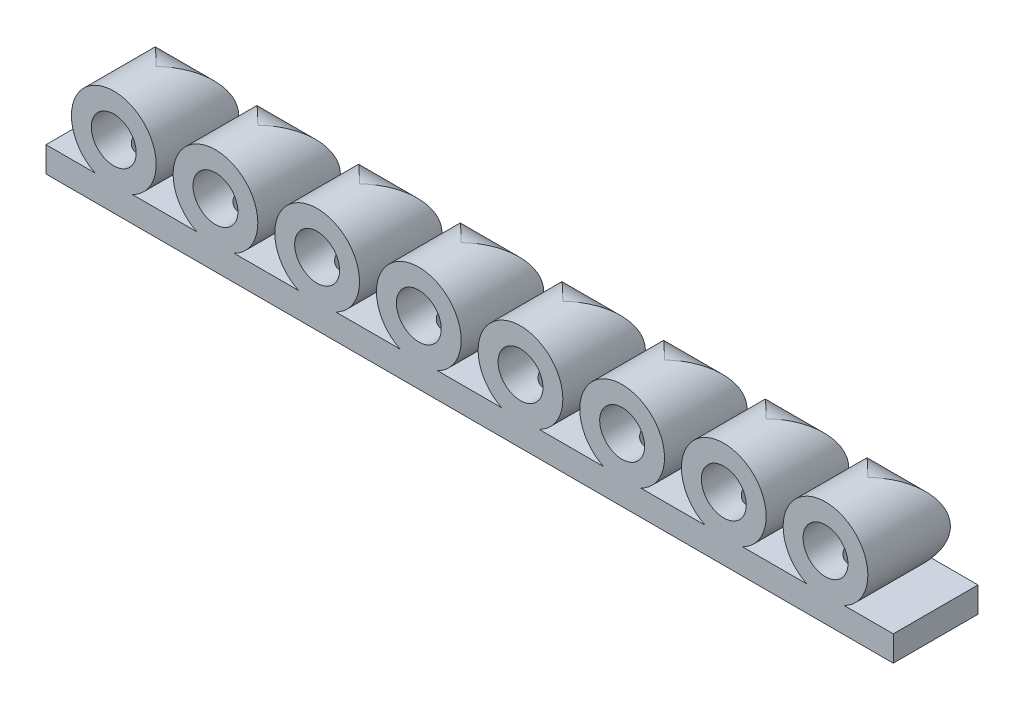
from build123d import *
from build123d.topology import SkipClean

# Parameters (mm, degrees)
BOSS_EXTRUDE1_DEPTH = 10
CUT_EXTRUDE1_DEPTH  = 102.097506416
SKETCH3_R           = 2.65
CUT_EXTRUDE2_DEPTH  = 8
SKETCH4_R           = 1.5
CUT_EXTRUDE3_DEPTH  = 8


with BuildPart() as part:
    # Sketch1 → Boss-Extrude1 (new body)
    with BuildSketch(Plane.XY):
        with BuildLine():
            Line((-39.793136328, 1.5), (-32.206863672, 1.5))
            ThreePointArc((-32.206863672, 1.5), (-30, 10.986619299), (-27.793136328, 1.5))
            Line((-27.793136328, 1.5), (-20.206863672, 1.5))
            ThreePointArc((-20.206863672, 1.5), (-18, 10.986619299), (-15.793136328, 1.5))
            Line((-15.793136328, 1.5), (-8.206863672, 1.5))
            ThreePointArc((-8.206863672, 1.5), (-6, 10.986619299), (-3.793136328, 1.5))
            Line((-3.793136328, 1.5), (3.793136328, 1.5))
            ThreePointArc((3.793136328, 1.5), (6, 10.986619299), (8.206863672, 1.5))
            Line((8.206863672, 1.5), (15.793136328, 1.5))
            ThreePointArc((15.793136328, 1.5), (18, 10.986619299), (20.206863672, 1.5))
            Line((20.206863672, 1.5), (27.793136328, 1.5))
            ThreePointArc((27.793136328, 1.5), (30, 10.986619299), (32.206863672, 1.5))
            Line((32.206863672, 1.5), (39.793136328, 1.5))
            ThreePointArc((39.793136328, 1.5), (42, 10.986619299), (44.206863672, 1.5))
            Line((44.206863672, 1.5), (50, 1.5))
            Line((50, 1.5), (50, -1.5))
            Line((50, -1.5), (-50, -1.5))
            Line((-50, -1.5), (-50, 1.5))
            Line((-50, 1.5), (-44.206863672, 1.5))
            ThreePointArc((-44.206863672, 1.5), (-42, 10.986619299), (-39.793136328, 1.5))
        make_face()
    extrude(amount=BOSS_EXTRUDE1_DEPTH)

    # Sketch2 → Cut-Extrude1 (cut, through all)
    with SkipClean():  # the faces are left unmerged after this step: merging them gives an invalid solid
        with BuildSketch(Plane.ZY.offset(50)):
            with BuildLine():
                Line((5, 10.986619299), (0, 10.986619299))
                Line((0, 10.986619299), (0, 1.5))
                Line((0, 1.5), (5, 1.5))
                ThreePointArc((5, 1.5), (0.25669035, 6.24330965), (5, 10.986619299))
            make_face()
        extrude(amount=-CUT_EXTRUDE1_DEPTH, mode=Mode.SUBTRACT)

    # Sketch3 → Cut-Extrude2 (cut)
    with SkipClean():  # the faces are left unmerged after this step: merging them gives an invalid solid
        with BuildSketch(Plane.XY.offset(10)):
            with Locations((-42, 5.986619299)):
                Circle(SKETCH3_R)
            with Locations((-30, 5.986619299)):
                Circle(SKETCH3_R)
            with Locations((-18, 5.986619299)):
                Circle(SKETCH3_R)
            with Locations((-6, 5.986619299)):
                Circle(SKETCH3_R)
            with Locations((6, 5.986619299)):
                Circle(SKETCH3_R)
            with Locations((18, 5.986619299)):
                Circle(SKETCH3_R)
            with Locations((30, 5.986619299)):
                Circle(SKETCH3_R)
            with Locations((42, 5.986619299)):
                Circle(SKETCH3_R)
        extrude(amount=-CUT_EXTRUDE2_DEPTH, mode=Mode.SUBTRACT)

    # Sketch4 → Cut-Extrude3 (cut)
    with SkipClean():  # the faces are left unmerged after this step: merging them gives an invalid solid
        with BuildSketch(Plane.XZ.offset(1.5)):
            with Locations((-42, 5.813665972)):
                Circle(SKETCH4_R)
            with Locations((-30, 5.813665972)):
                Circle(SKETCH4_R)
            with Locations((-18, 5.813665972)):
                Circle(SKETCH4_R)
            with Locations((-6, 5.813665972)):
                Circle(SKETCH4_R)
            with Locations((6, 5.813665972)):
                Circle(SKETCH4_R)
            with Locations((18, 5.813665972)):
                Circle(SKETCH4_R)
            with Locations((30, 5.813665972)):
                Circle(SKETCH4_R)
            with Locations((42, 5.813665972)):
                Circle(SKETCH4_R)
        extrude(amount=-CUT_EXTRUDE3_DEPTH, mode=Mode.SUBTRACT)


solid = part.part
